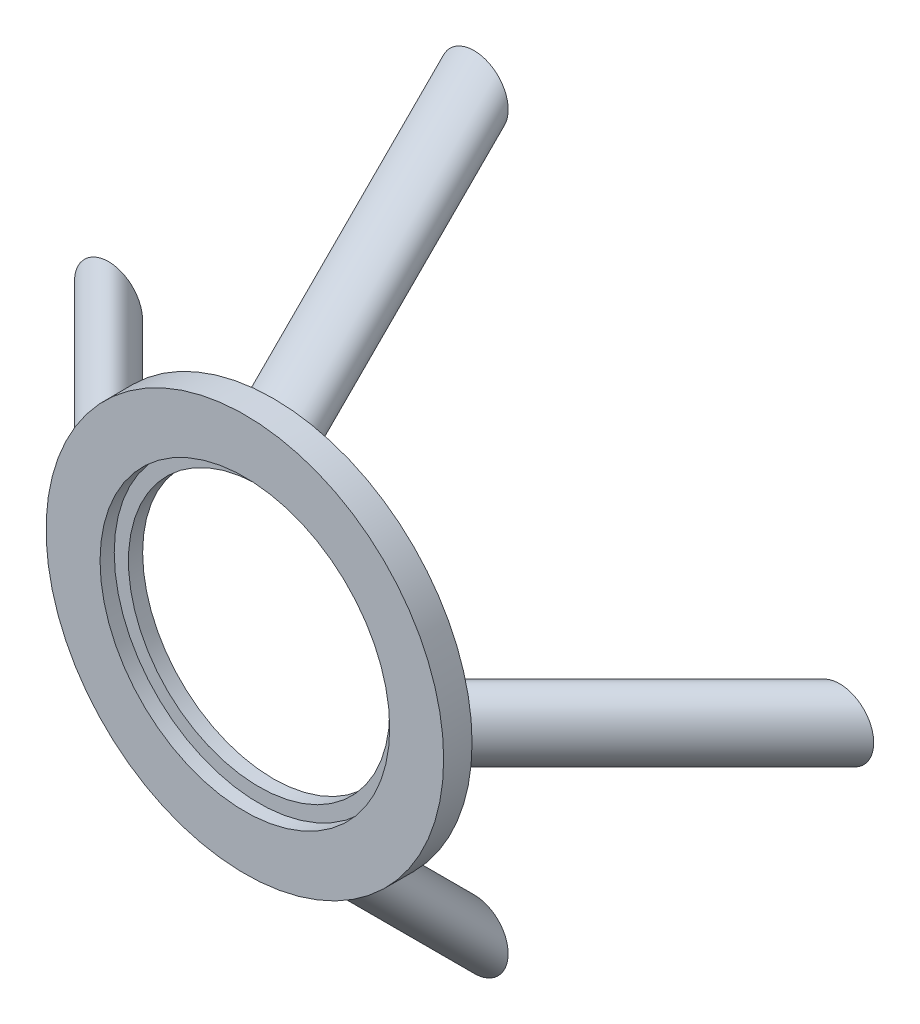
from build123d import *

# Parameters (mm, degrees)
SKETCH1_R           = 70
SKETCH1_R_2         = 51
BOSS_EXTRUDE1_DEPTH = 10
SKETCH1_6_R         = 51
SKETCH1_6_R_2       = 46
BOSS_EXTRUDE3_DEPTH = 5
SKETCH2_R           = 12
CIRPATTERN2_COUNT   = 4


with BuildPart() as part:
    # Sketch1 → Boss-Extrude1 (new body)
    with BuildSketch(Plane.XY):
        Circle(SKETCH1_R)
        Circle(SKETCH1_R_2, mode=Mode.SUBTRACT)
    extrude(amount=BOSS_EXTRUDE1_DEPTH)

    # Sketch1<6> → Boss-Extrude3 (add)
    with BuildSketch(Plane.XY):
        Circle(SKETCH1_6_R)
        Circle(SKETCH1_6_R_2, mode=Mode.SUBTRACT)
    extrude(amount=BOSS_EXTRUDE3_DEPTH)

    # Sweep1: sweep along a path in Sketch3
    with BuildLine(Plane(origin=(0, 0, 0), x_dir=(0, 0, -1), z_dir=(1, 0, 0))) as sweep1_path:
        Line((0, -58), (70.710678119, -128.710678119))
    # Sketch2 → Sweep1 (sweep)
    with BuildSketch(Plane(origin=(0, 0, 0), x_dir=(-1, 0, 0), z_dir=(0, 0, -1))):
        with Locations((0, -58)):
            Circle(SKETCH2_R)
    sweep1 = sweep(path=sweep1_path.line)

    # CirPattern2: Sweep1 ×4 about axis
    cirpattern2_axis = Axis((0, 0, 10), (0, 0, -1))
    for i in range(1, CIRPATTERN2_COUNT):
        add(sweep1.rotate(cirpattern2_axis, i * 360 / CIRPATTERN2_COUNT))


solid = part.part
